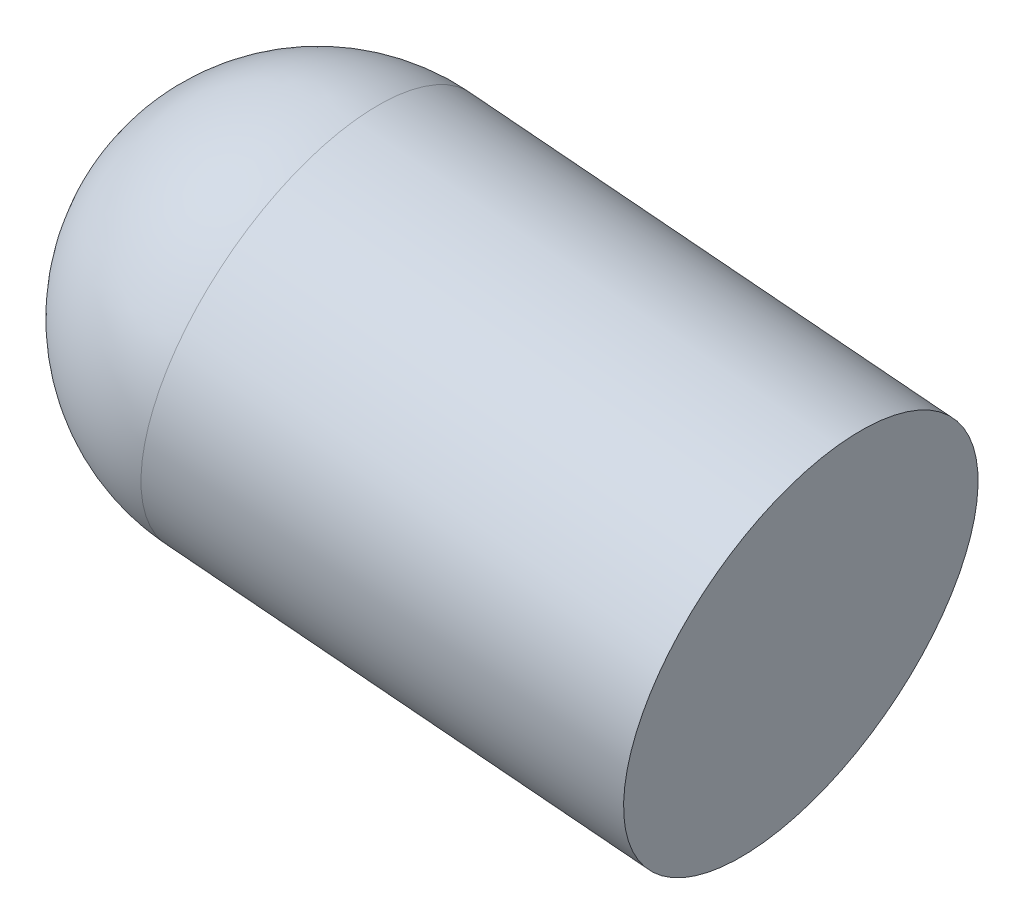
from build123d import *

# Parameters (mm, degrees)
SKETCH3_R           = 15
BOSS_EXTRUDE2_DEPTH = 50
FILLET2_R           = 15
SKALA1_SCALE        = 0.9168


# Read off the part's stored shape, not the designer's step: Bill Native-24-surface1
with BuildPart() as part:
    # Sketch3 → Boss-Extrude2 (new body)
    with BuildSketch(Plane(origin=(-228.533654814, 43.49726387, 22.444633169), x_dir=(0.09433999088090143, -0.017955917609401736, 0.9953780945667812), z_dir=(-0.9778241994721283, 0.18611121962441501, 0.09603358192113937))):
        with Locations(Location((-125.55600213, 167.584285081, 0), (0, 0, 270))):
            Circle(SKETCH3_R)
    extrude(amount=BOSS_EXTRUDE2_DEPTH)

    # Fillet2
    fillet2_edges = [part.edges().sort_by_distance(p)[0] for p in [
        (-255.131046735, 234.421635482, -97.729381896),
    ]]
    fillet(fillet2_edges, radius=FILLET2_R)


with BuildPart() as part_1:
    # Skala1: scaled about (-231.1813212, 214.593956787, -100.356967401)
    add(part.part.scale(SKALA1_SCALE).moved(Location((-19.234285924, 17.854217205, -8.349699688))))


solid = part_1.part
